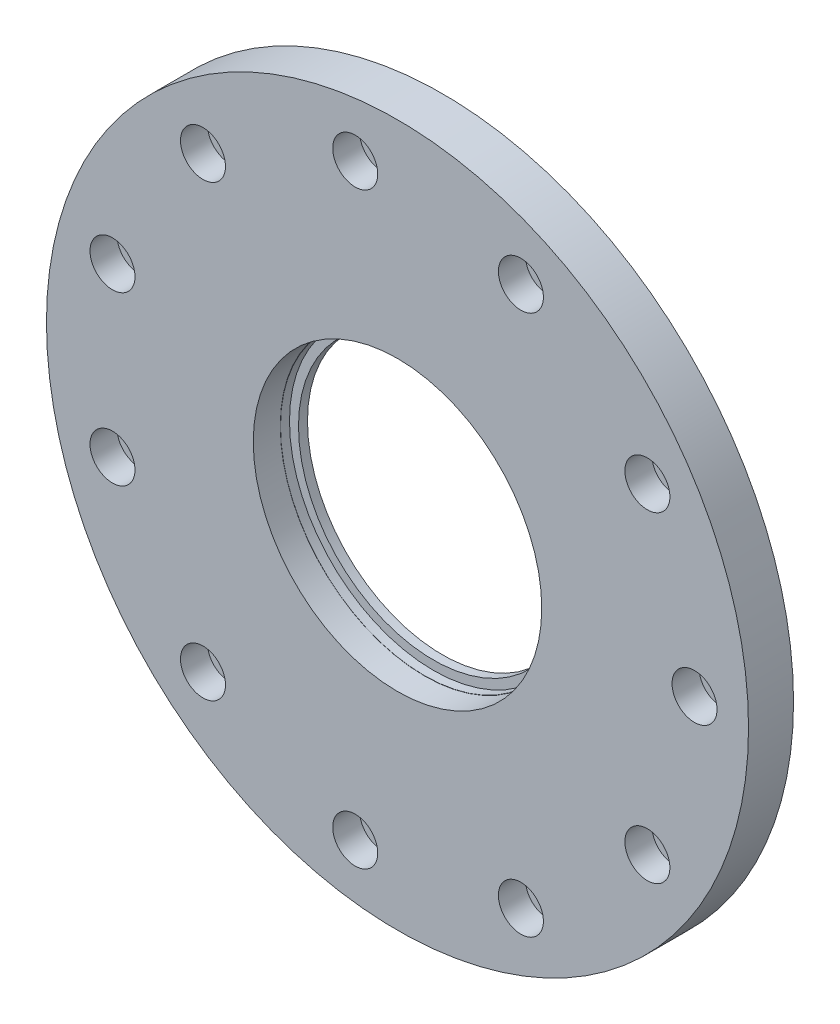
from build123d import *

# Parameters (mm, degrees)
SKETCH1_R           = 39
SKETCH1_R_2         = 2.5
SKETCH1_R_3         = 16.025
BOSS_EXTRUDE1_DEPTH = 3
BOSS_EXTRUDE2_START = 2
SKETCH2_R           = 39
SKETCH2_R_2         = 16
BOSS_EXTRUDE2_DEPTH = 2
SKETCH3_R           = 1.6
CUT_EXTRUDE1_DEPTH  = 56.380501984
SKETCH4_R           = 16
SKETCH4_R_2         = 15
BOSS_EXTRUDE3_DEPTH = 1


with BuildPart() as part:
    # Sketch1 → Boss-Extrude1 (new body)
    with BuildSketch(Plane.XY):
        Circle(SKETCH1_R)
        with Locations((33, 0)):
            Circle(SKETCH1_R_2, mode=Mode.SUBTRACT)
        with Locations((27.761366583, -17.841146976)):
            Circle(SKETCH1_R_2, mode=Mode.SUBTRACT)
        with Locations((13.708695429, -30.017855847)):
            Circle(SKETCH1_R_2, mode=Mode.SUBTRACT)
        with Locations((-4.696389663, -32.664107582)):
            Circle(SKETCH1_R_2, mode=Mode.SUBTRACT)
        with Locations((-21.61040422, -24.939735954)):
            Circle(SKETCH1_R_2, mode=Mode.SUBTRACT)
        with Locations((-31.663268129, -9.297174376)):
            Circle(SKETCH1_R_2, mode=Mode.SUBTRACT)
        with Locations((-31.663268129, 9.297174376)):
            Circle(SKETCH1_R_2, mode=Mode.SUBTRACT)
        with Locations((-21.61040422, 24.939735954)):
            Circle(SKETCH1_R_2, mode=Mode.SUBTRACT)
        with Locations((-4.696389663, 32.664107582)):
            Circle(SKETCH1_R_2, mode=Mode.SUBTRACT)
        with Locations((13.708695429, 30.017855847)):
            Circle(SKETCH1_R_2, mode=Mode.SUBTRACT)
        with Locations((27.761366583, 17.841146976)):
            Circle(SKETCH1_R_2, mode=Mode.SUBTRACT)
        Circle(SKETCH1_R_3, mode=Mode.SUBTRACT)
    extrude(amount=BOSS_EXTRUDE1_DEPTH)

    # Sketch2 → Boss-Extrude2 (add)
    with BuildSketch(Plane(origin=(0, 0, 0), x_dir=(-1, 0, 0), z_dir=(0, 0, -1)).offset(BOSS_EXTRUDE2_START)):
        Circle(SKETCH2_R)
        Circle(SKETCH2_R_2, mode=Mode.SUBTRACT)
    extrude(amount=-BOSS_EXTRUDE2_DEPTH)

    # Sketch3 → Cut-Extrude1 (cut, through all)
    with BuildSketch(Plane.XY.offset(3)):
        with Locations((33, 0)):
            Circle(SKETCH3_R)
        with Locations((27.761366583, -17.841146976)):
            Circle(SKETCH3_R)
        with Locations((13.708695429, -30.017855847)):
            Circle(SKETCH3_R)
        with Locations((-4.696389663, -32.664107582)):
            Circle(SKETCH3_R)
        with Locations((-21.61040422, -24.939735954)):
            Circle(SKETCH3_R)
        with Locations((-31.663268129, -9.297174376)):
            Circle(SKETCH3_R)
        with Locations((-31.663268129, 9.297174376)):
            Circle(SKETCH3_R)
        with Locations((-21.61040422, 24.939735954)):
            Circle(SKETCH3_R)
        with Locations((-4.696389663, 32.664107582)):
            Circle(SKETCH3_R)
        with Locations((13.708695429, 30.017855847)):
            Circle(SKETCH3_R)
        with Locations((27.761366583, 17.841146976)):
            Circle(SKETCH3_R)
    extrude(amount=-CUT_EXTRUDE1_DEPTH, mode=Mode.SUBTRACT)

    # Sketch4 → Boss-Extrude3 (add)
    with BuildSketch(Plane(origin=(0, 0, -2), x_dir=(-1, 0, 0), z_dir=(0, 0, -1))):
        Circle(SKETCH4_R)
        Circle(SKETCH4_R_2, mode=Mode.SUBTRACT)
    extrude(amount=-BOSS_EXTRUDE3_DEPTH)


solid = part.part
